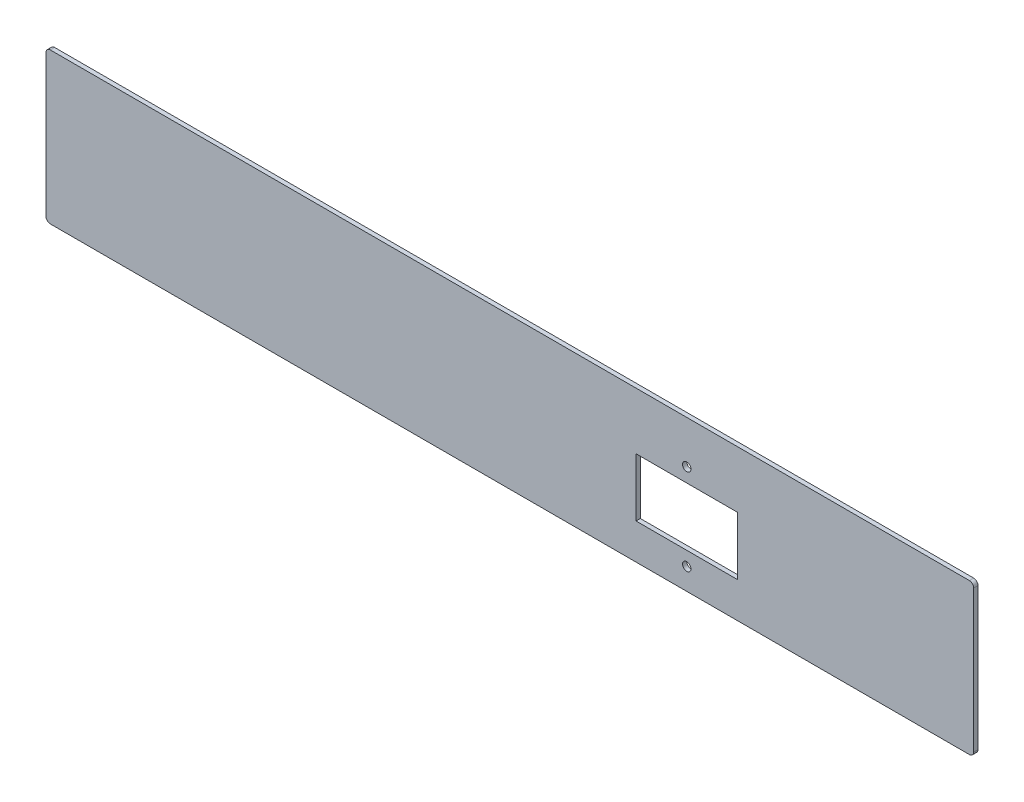
from build123d import *

# Parameters (mm, degrees)
SKETCH1_W           = 430
SKETCH1_H           = 69.85
SKETCH1_R           = 1.95
SKETCH1_W_2         = 47
SKETCH1_H_2         = 27
BOSS_EXTRUDE1_DEPTH = 2
FILLET1_R           = 2


with BuildPart() as part:
    # Sketch1 → Boss-Extrude1 (new body)
    with BuildSketch(Plane.XY):
        with Locations((-137.924811832, 0.628517588)):
            Rectangle(SKETCH1_W, SKETCH1_H)
        with Locations((-55.924811832, 15.703517588)):
            Circle(SKETCH1_R, mode=Mode.SUBTRACT)
        with Locations((-55.924811832, -24.296482412)):
            Circle(SKETCH1_R, mode=Mode.SUBTRACT)
        with Locations((-55.924811832, -4.296482412)):
            Rectangle(SKETCH1_W_2, SKETCH1_H_2, mode=Mode.SUBTRACT)
    extrude(amount=BOSS_EXTRUDE1_DEPTH)

    # Fillet1
    fillet1_edges = [part.edges().sort_by_distance(p)[0] for p in [
        (77.075188168, 35.553517588, 1),
        (77.075188168, -34.296482412, 1),
        (-352.924811832, -34.296482412, 1),
        (-352.924811832, 35.553517588, 1),
    ]]
    fillet(fillet1_edges, radius=FILLET1_R)


solid = part.part
